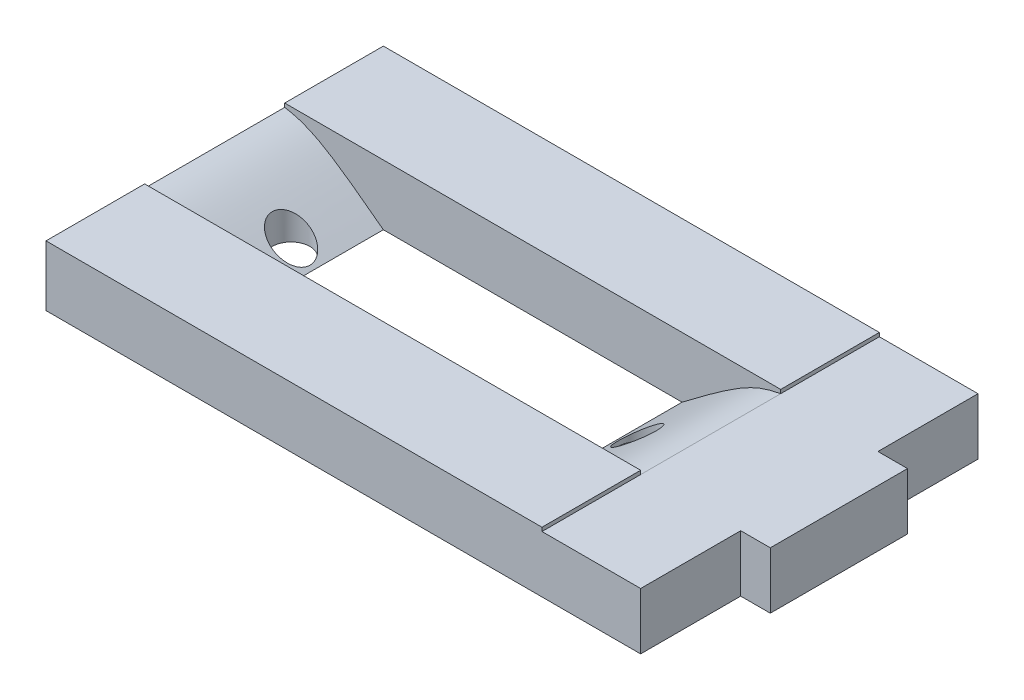
from build123d import *

# Parameters (mm, degrees)
SKETCH_1_W                = 50.28
SKETCH_1_H                = 34.2
SKETCH_1_W_2              = 30.28
SKETCH_1_H_2              = 14.2
EXTRUDE_1_DEPTH           = 12.25
SKETCH_4_W                = 13
SKETCH_4_H                = 13.91
EXTRUDE_1_2_DEPTH         = 74.82
SKETCH_5_W                = 13.91
SKETCH_5_H                = 16.23
EXTRUDE_2_DEPTH           = 16
SKETCH_7_R                = 25.25
SKETCH_7_R_2              = 15.25
EXTRUDE_2_2_DEPTH         = 16.23
SKETCH_15_R               = 1.91
CUT_EXTRUDE_6_DEPTH       = 97.964478439
SKETCH_16_W               = 13.91
SKETCH_16_H               = 16.23
EXTRUDE_4_DEPTH           = 10
SKETCH_17_R               = 1.91
CUT_EXTRUDE_7_DEPTH       = 102.16913771
SKETCH_18_W               = 49.344544624
SKETCH_18_H               = 6.125
CUT_EXTRUDE_8_DEPTH       = 105.840616652
SKETCH_19_W               = 34.2
SKETCH_19_H               = 6.125
CUT_EXTRUDE_9_DEPTH       = 10
SKETCH_21_R               = 1.91
CUT_EXTRUDE_10_DEPTH      = 10
SKETCH_20_R               = 1.91
CUT_EXTRUDE_11_DEPTH      = 10
FILLET_START              = -7.1
FILLET_1_DEPTH            = 14.2
FILLET_2_DEPTH            = 14.2
SKETCH_29_W               = 13.91
SKETCH_29_H               = 74.82
EXTRUDE_5_DEPTH           = 10
SKETCH_30_W               = 10
SKETCH_30_H               = 58.59
CUT_EXTRUDE_13_DEPTH      = 102.16913771
SKETCH_32_W               = 34.2
SKETCH_32_H               = 5.745736365
EXTRUDE_6_DEPTH           = 10
CUT_EXTRUDE_16_DEPTH      = 50
CUT_EXTRUDE_16_DEPTH_BACK = 50
SKETCH_38_W               = 116.985630298
SKETCH_38_H               = 80.538350638
SKETCH_41_W               = 13.91
SKETCH_41_H               = 5.745736365
EXTRUDE_7_DEPTH           = 3


with BuildPart() as part:
    # 草圖1 → Extrude 1 (new body)
    with BuildSketch(Plane(origin=(0, 0, 0), x_dir=(1, 0, 0), z_dir=(0, 1, 0))):
        Rectangle(SKETCH_1_W, SKETCH_1_H)
        Rectangle(SKETCH_1_W_2, SKETCH_1_H_2, mode=Mode.SUBTRACT)
    extrude(amount=EXTRUDE_1_DEPTH)

    # 草圖4 → Extrude 1 2 (add)
    with BuildSketch(Plane.XZ):
        with Locations((18.64, 0)):
            Rectangle(SKETCH_4_W, SKETCH_4_H)
    extrude(amount=EXTRUDE_1_2_DEPTH)

    # 草圖5 → Extrude 2 (add)
    with BuildSketch(Plane.ZY.offset(-12.14)):
        with Locations((0, -66.705)):
            Rectangle(SKETCH_5_W, SKETCH_5_H)
    extrude(amount=EXTRUDE_2_DEPTH)

    # 草圖7 → Extrude 2 2 (add)
    with BuildSketch(Plane(origin=(3.626674765, -74.82, 0), x_dir=(1, 0, 0), z_dir=(0, -1, 0))):
        with Locations((-30.978154344, 0)):
            Circle(SKETCH_7_R)
        with Locations((-30.978154344, 0)):
            Circle(SKETCH_7_R_2, mode=Mode.SUBTRACT)
    extrude(amount=-EXTRUDE_2_2_DEPTH)

    # 草圖15 → 除料-伸長6 (cut, through all)
    with BuildSketch(Plane(origin=(0, 0, -6.955), x_dir=(-1, 0, 0), z_dir=(0, 0, -1))):
        with Locations((-4.530883248, -66.705)):
            Circle(SKETCH_15_R)
    extrude(amount=-CUT_EXTRUDE_6_DEPTH, mode=Mode.SUBTRACT)

    # 草圖16 → 填料-伸長4 (add)
    with BuildSketch(Plane(origin=(-60, 0, 0), x_dir=(0, 0, -1), z_dir=(1, 0, 0))):
        with Locations((0, -66.705)):
            Rectangle(SKETCH_16_W, SKETCH_16_H)
    extrude(amount=EXTRUDE_4_DEPTH)

    # 草圖17 → 除料-伸長7 (cut, through all)
    with BuildSketch(Plane(origin=(0, 0, -6.955), x_dir=(-1, 0, 0), z_dir=(0, 0, -1))):
        with Locations((55.812362827, -66.705)):
            Circle(SKETCH_17_R)
    extrude(amount=-CUT_EXTRUDE_7_DEPTH, mode=Mode.SUBTRACT)

    # 草圖18 → 除料-伸長8 (cut, through all)
    with BuildSketch(Plane(origin=(0, 0, -17.1), x_dir=(-1, 0, 0), z_dir=(0, 0, -1))):
        with Locations((0.467727688, 9.1875)):
            Rectangle(SKETCH_18_W, SKETCH_18_H)
    extrude(amount=-CUT_EXTRUDE_8_DEPTH, mode=Mode.SUBTRACT)

    # 草圖19 → 除料-伸長9 (cut)
    with BuildSketch(Plane.ZY.offset(-24.204544624)):
        with Locations((0, 9.1875)):
            Rectangle(SKETCH_19_W, SKETCH_19_H)
    extrude(amount=-CUT_EXTRUDE_9_DEPTH, mode=Mode.SUBTRACT)

    # 草圖21 → 除料-伸長10 (cut)
    with BuildSketch(Plane(origin=(0, 6.125, 0), x_dir=(1, 0, 0), z_dir=(0, 1, 0))):
        with Locations(Location((17.69, 0, 0), (0, 0, 270))):
            Circle(SKETCH_21_R)
    extrude(amount=-CUT_EXTRUDE_10_DEPTH, mode=Mode.SUBTRACT)

    # 草圖20 → 除料-伸長11 (cut)
    with BuildSketch(Plane(origin=(0, 6.125, 0), x_dir=(1, 0, 0), z_dir=(0, 1, 0))):
        with Locations(Location((-17.395, 0, 0), (0, 0, 270))):
            Circle(SKETCH_20_R)
    extrude(amount=-CUT_EXTRUDE_11_DEPTH, mode=Mode.SUBTRACT)

    # 圓角1: read off the stored shape, not the designer's step
    # 圓角1 outline → 圓角1 (cut)
    with BuildSketch(Plane.XY.offset(FILLET_START)):
        with BuildLine():
            add(Edge.make_bspline(
                [(-15.14, 0), (-21.974170252, 5.199829476), (-25.14, 5.745736365)],
                knots=[0, 0, 0, 0.664102345, 0.664102345, 0.664102345], degree=2, weights=[1, 2.223777218, 1.822127795]))
            Line((-15.14, 0), (-15.14, 6.125))
            Line((-15.14, 6.125), (-25.14, 6.125))
            Line((-25.14, 6.125), (-25.14, 5.745736365))
        make_face()
    extrude(amount=FILLET_1_DEPTH, mode=Mode.SUBTRACT)

    # 圓角2: read off the stored shape, not the designer's step
    # 圓角2 outline → 圓角2 (cut)
    with BuildSketch(Plane.XY.offset(FILLET_START)):
        with BuildLine():
            Line((15.14, 6.125), (15.14, 0))
            add(Edge.make_bspline(
                [(15.14, 0), (21.974170252, 5.199829476), (25.14, 5.745736365)],
                knots=[0, 0, 0, 0.664102345, 0.664102345, 0.664102345], degree=2, weights=[1, 2.223777218, 1.822127795]))
            Line((25.14, 5.745736365), (25.14, 6.125))
            Line((25.14, 6.125), (15.14, 6.125))
        make_face()
    extrude(amount=FILLET_2_DEPTH, mode=Mode.SUBTRACT)

    # 草圖29 → 填料-伸長5 (add)
    with BuildSketch(Plane(origin=(25.14, 0, 0), x_dir=(0, 0, -1), z_dir=(1, 0, 0))):
        with Locations((0, -37.41)):
            Rectangle(SKETCH_29_W, SKETCH_29_H)
    extrude(amount=EXTRUDE_5_DEPTH)

    # 草圖30 → 除料-伸長13 (cut, through all)
    with BuildSketch(Plane.XY.offset(6.955)):
        with Locations((17.14, -29.295)):
            Rectangle(SKETCH_30_W, SKETCH_30_H)
    extrude(amount=-CUT_EXTRUDE_13_DEPTH, mode=Mode.SUBTRACT)

    # 草圖32 → 填料-伸長6 (add)
    with BuildSketch(Plane(origin=(25.14, 0, 0), x_dir=(0, 0, -1), z_dir=(1, 0, 0))):
        with Locations((0, 2.872868182)):
            Rectangle(SKETCH_32_W, SKETCH_32_H)
    extrude(amount=EXTRUDE_6_DEPTH)

    # 草圖38 → 除料-伸長16 (cut, two sides: drawn at the far end of the back side and taken through both)
    with BuildSketch(Plane(origin=(0, 0, -6.955), x_dir=(-1, 0, 0), z_dir=(0, 0, -1)).offset(-CUT_EXTRUDE_16_DEPTH_BACK)):
        with Locations((7.268869252, -40.269175319)):
            Rectangle(SKETCH_38_W, SKETCH_38_H)
    extrude(amount=CUT_EXTRUDE_16_DEPTH + CUT_EXTRUDE_16_DEPTH_BACK, mode=Mode.SUBTRACT)

    # 草圖41 → 填料-伸長7 (add)
    with BuildSketch(Plane(origin=(35.14, 0, 0), x_dir=(0, 0, -1), z_dir=(1, 0, 0))):
        with Locations((0, 2.872868182)):
            Rectangle(SKETCH_41_W, SKETCH_41_H)
    extrude(amount=EXTRUDE_7_DEPTH)


solid = part.part
